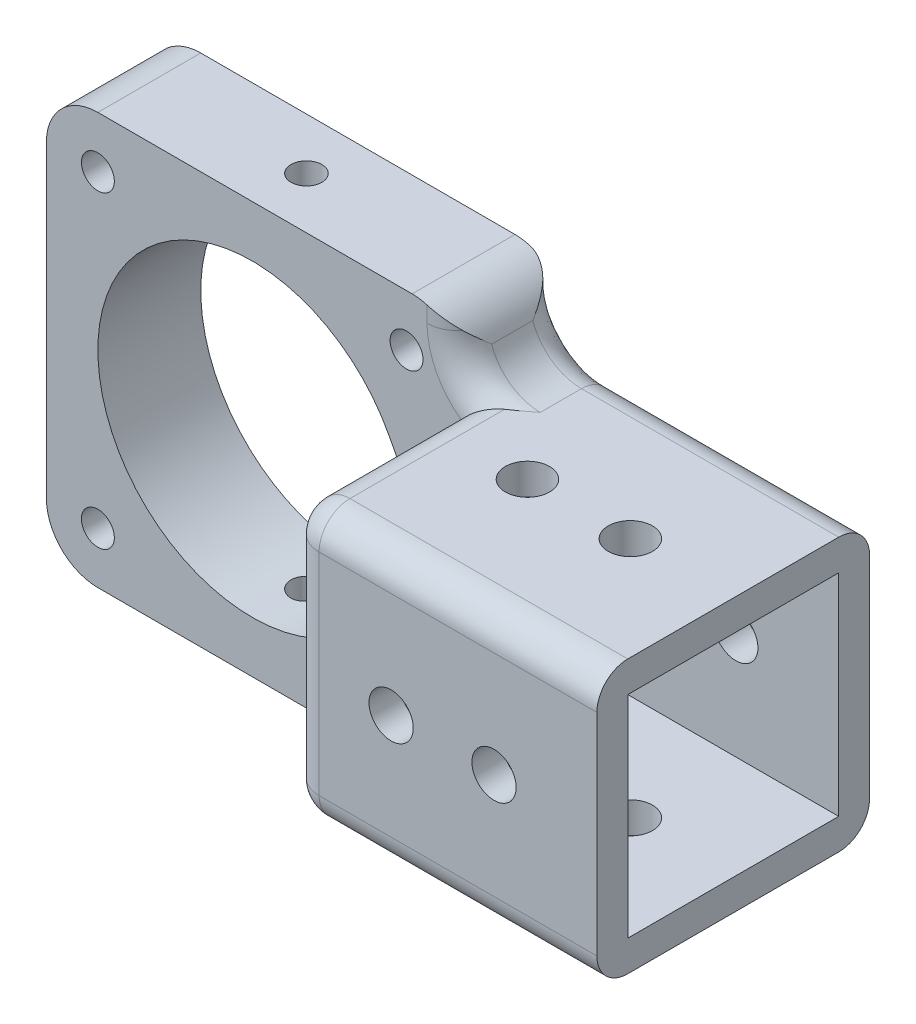
from build123d import *

# Parameters (mm, degrees)
SKETCH_1_W           = 17.5
SKETCH_1_H           = 17.5
EXTRUDE_1_DEPTH      = 30
SKETCH_2_W           = 20.5
SKETCH_2_H           = 20.5
SKETCH_2_W_2         = 17.5
SKETCH_2_H_2         = 17.5
EXTRUDE_2_DEPTH      = 2
SKETCH_3_W           = 26.5
SKETCH_3_H           = 26.5
SKETCH_3_W_2         = 20.5
SKETCH_3_H_2         = 20.5
EXTRUDE_3_DEPTH      = 30
SKETCH_4_R           = 2.15
CUT_EXTRUDE_6_DEPTH  = 43.164113888
SKETCH_6_W           = 10
SKETCH_6_H           = 26.5
SKETCH_6_H_2         = 6.75
EXTRUDE_5_DEPTH      = 40
SKETCH_14_R          = 1.6
CUT_EXTRUDE_9_DEPTH  = 52.983170353
FILLET_START         = -13.25
FILLET_25_DEPTH      = 10
FILLET_26_DEPTH      = 10
FILLET_28_R          = 3
FILLET_29_R          = 3
FILLET_30_R          = 3
FILLET_31_R          = 3
FILLET_32_R          = 3
FILLET_33_R          = 3
FILLET_34_R          = 3
FILLET_35_R          = 5
FILLET_START_2       = -14
FILLET_36_DEPTH      = 12
FILLET_37_DEPTH      = 12
FILLET_38_R          = 5
SKETCH_5_R           = 2.15
CUT_EXTRUDE_10_DEPTH = 52.983170469
SKETCH_15_W          = 17.5
SKETCH_15_H          = 17.5
CUT_EXTRUDE_12_DEPTH = 28
CUT_EXTRUDE_13_DEPTH = 28
CUT_EXTRUDE_14_DEPTH = 59.099591381


with BuildPart() as part:
    # 草图1 → 凸台-拉伸1 (new body)
    with BuildSketch(Plane(origin=(0, 0, 0), x_dir=(0, 0, -1), z_dir=(1, 0, 0))):
        Rectangle(SKETCH_1_W, SKETCH_1_H)
    extrude(amount=EXTRUDE_1_DEPTH)

    # 草图2 → 凸台-拉伸2 (add)
    with BuildSketch(Plane.ZY):
        Rectangle(SKETCH_2_W, SKETCH_2_H)
        Rectangle(SKETCH_2_W_2, SKETCH_2_H_2, mode=Mode.SUBTRACT)
    extrude(amount=-EXTRUDE_2_DEPTH)

    # 草图3 → 凸台-拉伸3 (add)
    with BuildSketch(Plane.ZY):
        Rectangle(SKETCH_3_W, SKETCH_3_H)
        Rectangle(SKETCH_3_W_2, SKETCH_3_H_2, mode=Mode.SUBTRACT)
    extrude(amount=-EXTRUDE_3_DEPTH)

    # 草图4 → 切除-拉伸6 (cut, through all)
    with BuildSketch(Plane(origin=(0, 13.25, 0), x_dir=(1, 0, 0), z_dir=(0, 1, 0))):
        with Locations(Location((10, 0, 0), (0, 0, 270))):
            Circle(SKETCH_4_R)
        with Locations(Location((20, 0, 0), (0, 0, 270))):
            Circle(SKETCH_4_R)
    extrude(amount=-CUT_EXTRUDE_6_DEPTH, mode=Mode.SUBTRACT)

    # 草图6 → 凸台-拉伸5 (add)
    with BuildSketch(Plane.ZY):
        with Locations((-8.25, 0)):
            Rectangle(SKETCH_6_W, SKETCH_6_H)
        with Locations((-8.25, 16.625)):
            Rectangle(SKETCH_6_W, SKETCH_6_H_2)
        with Locations((-8.25, -16.625)):
            Rectangle(SKETCH_6_W, SKETCH_6_H_2)
    extrude(amount=EXTRUDE_5_DEPTH)

    # 草图14 → 切除-拉伸9 (cut, through all)
    with BuildSketch(Plane(origin=(0, 0, -13.25), x_dir=(-1, 0, 0), z_dir=(0, 0, -1))):
        with BuildLine():
            ThreePointArc((20, 15), (5, 0), (20, -15))
            Line((20, -15), (20, 15))
        make_face()
        with BuildLine():
            Line((20, 15), (20, -15))
            ThreePointArc((20, -15), (30.606601718, -10.606601718), (35, 0))
            ThreePointArc((35, 0), (30.606601718, 10.606601718), (20, 15))
        make_face()
        with Locations((5, -15)):
            Circle(SKETCH_14_R)
        with Locations((35, -15)):
            Circle(SKETCH_14_R)
        with Locations((35, 15)):
            Circle(SKETCH_14_R)
        with Locations((5, 15)):
            Circle(SKETCH_14_R)
    extrude(amount=-CUT_EXTRUDE_9_DEPTH, mode=Mode.SUBTRACT)

    # 圆角25: read off the stored shape, not the designer's step
    # 圆角25 outline → 圆角25 (add)
    with BuildSketch(Plane.XY.offset(FILLET_START)):
        with BuildLine():
            add(Edge.make_bspline(
                [(0, 18.25), (0, 13.25), (5, 13.25)],
                knots=[0, 0, 0, 1, 1, 1], degree=2, weights=[1, 0.707106781, 1]))
            Line((0, 18.25), (0, 13.25))
            Line((0, 13.25), (5, 13.25))
        make_face()
    extrude(amount=FILLET_25_DEPTH)

    # 圆角26: read off the stored shape, not the designer's step
    # 圆角26 outline → 圆角26 (add)
    with BuildSketch(Plane.XY.offset(FILLET_START)):
        with BuildLine():
            Line((0, -13.25), (0, -18.25))
            add(Edge.make_bspline(
                [(0, -18.25), (0, -13.25), (5, -13.25)],
                knots=[0, 0, 0, 1, 1, 1], degree=2, weights=[1, 0.707106781, 1]))
            Line((5, -13.25), (0, -13.25))
        make_face()
    extrude(amount=FILLET_26_DEPTH)

    # 圆角28
    fillet_28_edges = [part.edges().sort_by_distance(p)[0] for p in [
        (15, 13.25, 13.25),
        (0, 13.25, 5),
    ]]
    fillet(fillet_28_edges, radius=FILLET_28_R)

    # 圆角29
    # the kernel refuses this fillet: 3 mm, written as the material it takes off along each edge
    with BuildSketch(Plane(origin=(3, 10.25, 10.25), x_dir=(-1, 0, 0), z_dir=(0, 0, 1))) as fillet_29_piece_1_section:
        Polygon((0, 0), (FILLET_29_R, 0), (FILLET_29_R, -FILLET_29_R), (0, -FILLET_29_R), align=None)
    fillet_29_piece_1 = extrude(amount=FILLET_29_R, mode=Mode.PRIVATE)
    fillet_29_piece_1 = fillet_29_piece_1 - Plane(origin=(3, 10.25, 10.25), x_dir=(0.7071067811865475, -0.7071067811865475, 0), z_dir=(0, 0, 1)) * Sphere(FILLET_29_R, mode=Mode.PRIVATE)
    add(fillet_29_piece_1, mode=Mode.SUBTRACT)
    with BuildSketch(Plane(origin=(0, -20.75, 13.25), x_dir=(1, 0, 0), z_dir=(0, 1, 0))) as fillet_29_piece_2:
        with BuildLine():
            CenterArc((FILLET_29_R, FILLET_29_R), FILLET_29_R, 180, 90)
            Line((0, FILLET_29_R), (0, 0))
            Line((0, 0), (FILLET_29_R, 0))
        make_face()
    extrude(amount=31, mode=Mode.SUBTRACT)
    with BuildSketch(Plane(origin=(0, -13.25, -3.25), x_dir=(1, 0, 0), z_dir=(0, 0, 1))) as fillet_29_piece_3:
        with BuildLine():
            CenterArc((FILLET_29_R, FILLET_29_R), FILLET_29_R, 180, 90)
            Line((0, FILLET_29_R), (0, 0))
            Line((0, 0), (FILLET_29_R, 0))
        make_face()
    extrude(amount=24, mode=Mode.SUBTRACT)

    # 圆角30
    # the kernel refuses this fillet: 3 mm, written as the material it takes off along each edge
    with BuildSketch(Plane(origin=(3, -10.25, 10.25), x_dir=(0, -1, 0), z_dir=(0, 0, 1))) as fillet_30_piece_1_section:
        Polygon((0, 0), (FILLET_30_R, 0), (FILLET_30_R, -FILLET_30_R), (0, -FILLET_30_R), align=None)
    fillet_30_piece_1 = extrude(amount=FILLET_30_R, mode=Mode.PRIVATE)
    fillet_30_piece_1 = fillet_30_piece_1 - Plane(origin=(3, -10.25, 10.25), x_dir=(0.7071067811865475, 0.7071067811865475, 0), z_dir=(0, 0, 1)) * Sphere(FILLET_30_R, mode=Mode.PRIVATE)
    add(fillet_30_piece_1, mode=Mode.SUBTRACT)
    with BuildSketch(Plane(origin=(3, -13.25, 13.25), x_dir=(0, 1, 0), z_dir=(1, 0, 0))) as fillet_30_piece_2:
        with BuildLine():
            CenterArc((FILLET_30_R, -FILLET_30_R), FILLET_30_R, 90, 90)
            Line((0, -FILLET_30_R), (0, 0))
            Line((0, 0), (FILLET_30_R, 0))
        make_face()
    extrude(amount=34.5, mode=Mode.SUBTRACT)

    # 圆角31
    fillet_31_edges = [part.edges().sort_by_distance(p)[0] for p in [
        (0, -19.125, -13.25),
        (1.464466505, -14.714465683, -13.25),
        (17.5, -13.25, -13.25),
    ]]
    fillet(fillet_31_edges, radius=FILLET_31_R)

    # 圆角32
    fillet_32_edges = [part.edges().sort_by_distance(p)[0] for p in [
        (1.464466505, 14.714465683, -13.25),
        (17.5, 13.25, -13.25),
        (0, 19.125, -13.25),
    ]]
    fillet(fillet_32_edges, radius=FILLET_32_R)

    # 圆角33
    fillet_33_edges = [part.edges().sort_by_distance(p)[0] for p in [
        (0, 19.125, -3.25),
        (1.464466505, 14.714465683, -3.25),
    ]]
    fillet(fillet_33_edges, radius=FILLET_33_R)

    # 圆角34
    fillet_34_edges = [part.edges().sort_by_distance(p)[0] for p in [
        (1.464466505, -14.714465683, -3.25),
        (0, -19.125, -3.25),
    ]]
    fillet(fillet_34_edges, radius=FILLET_34_R)

    # 圆角35
    fillet_35_edges = [part.edges().sort_by_distance(p)[0] for p in [
        (-40, 20, -8.25),
    ]]
    fillet(fillet_35_edges, radius=FILLET_35_R)

    # 圆角36: read off the stored shape, not the designer's step
    # 圆角36 outline → 圆角36 (cut)
    with BuildSketch(Plane.XY.offset(FILLET_START_2)):
        with BuildLine():
            Line((0, 20), (-4.45714016, 20))
            ThreePointArc((-4.45714016, 20), (-1.55240265, 19.069705149), (0.27142992, 16.625))
            add(Edge.make_bspline(
                [(0, 18.25), (0, 17.414831015), (0.27142992, 16.625)],
                knots=[0, 0, 0, 0.220935453, 0.220935453, 0.220935453], degree=2, weights=[1, 0.935289504, 0.899172693]))
            Line((0, 18.25), (0, 20))
        make_face()
    extrude(amount=FILLET_36_DEPTH, mode=Mode.SUBTRACT)

    # 圆角37: read off the stored shape, not the designer's step
    # 圆角37 outline → 圆角37 (cut)
    with BuildSketch(Plane.XY.offset(FILLET_START_2)):
        with BuildLine():
            ThreePointArc((0.27142992, -16.625), (-1.55240265, -19.069705149), (-4.45714016, -20))
            Line((-4.45714016, -20), (0, -20))
            Line((0, -20), (0, -18.25))
            add(Edge.make_bspline(
                [(0, -18.25), (0, -17.414831015), (0.27142992, -16.625)],
                knots=[0, 0, 0, 0.220935453, 0.220935453, 0.220935453], degree=2, weights=[1, 0.935289504, 0.899172693]))
        make_face()
    extrude(amount=FILLET_37_DEPTH, mode=Mode.SUBTRACT)

    # 圆角38
    fillet_38_edges = [part.edges().sort_by_distance(p)[0] for p in [
        (-40, -20, -8.25),
    ]]
    fillet(fillet_38_edges, radius=FILLET_38_R)

    # 草图5 → 切除-拉伸10 (cut, through all)
    with BuildSketch(Plane(origin=(0, 0, -13.25), x_dir=(-1, 0, 0), z_dir=(0, 0, -1))):
        with Locations(Location((-20, 0, 0), (0, 0, 180))):
            Circle(SKETCH_5_R)
        with Locations(Location((-10, 0, 0), (0, 0, 180))):
            Circle(SKETCH_5_R)
    extrude(amount=-CUT_EXTRUDE_10_DEPTH, mode=Mode.SUBTRACT)

    # 草图15 → 切除-拉伸12 (cut)
    with BuildSketch(Plane(origin=(30, 0, 0), x_dir=(0, 0, -1), z_dir=(1, 0, 0))):
        Rectangle(SKETCH_15_W, SKETCH_15_H)
    extrude(amount=-CUT_EXTRUDE_12_DEPTH, mode=Mode.SUBTRACT)

    # 草图16 → 切除-拉伸13 (cut)
    with BuildSketch(Plane.XY.offset(-3.25)):
        Polygon((-3, 0), (-6.796133828, 7.117437609), (-6.764657472, -7.058732759), align=None)
    extrude(amount=-CUT_EXTRUDE_13_DEPTH, mode=Mode.SUBTRACT)

    # 草图17 → 切除-拉伸14 (cut, through all)
    with BuildSketch(Plane(origin=(0, 20, 0), x_dir=(1, 0, 0), z_dir=(0, 1, 0))):
        with BuildLine():
            ThreePointArc((-18.22857008, 8.25), (-18.667909908, 9.310660172), (-19.72857008, 9.75))
            Line((-19.72857008, 9.75), (-19.72857008, 6.75))
            ThreePointArc((-19.72857008, 6.75), (-18.667909908, 7.189339828), (-18.22857008, 8.25))
        make_face()
        with BuildLine():
            Line((-19.72857008, 6.75), (-19.72857008, 9.75))
            ThreePointArc((-19.72857008, 9.75), (-21.22857008, 8.25), (-19.72857008, 6.75))
        make_face()
    extrude(amount=-CUT_EXTRUDE_14_DEPTH, mode=Mode.SUBTRACT)


solid = part.part
